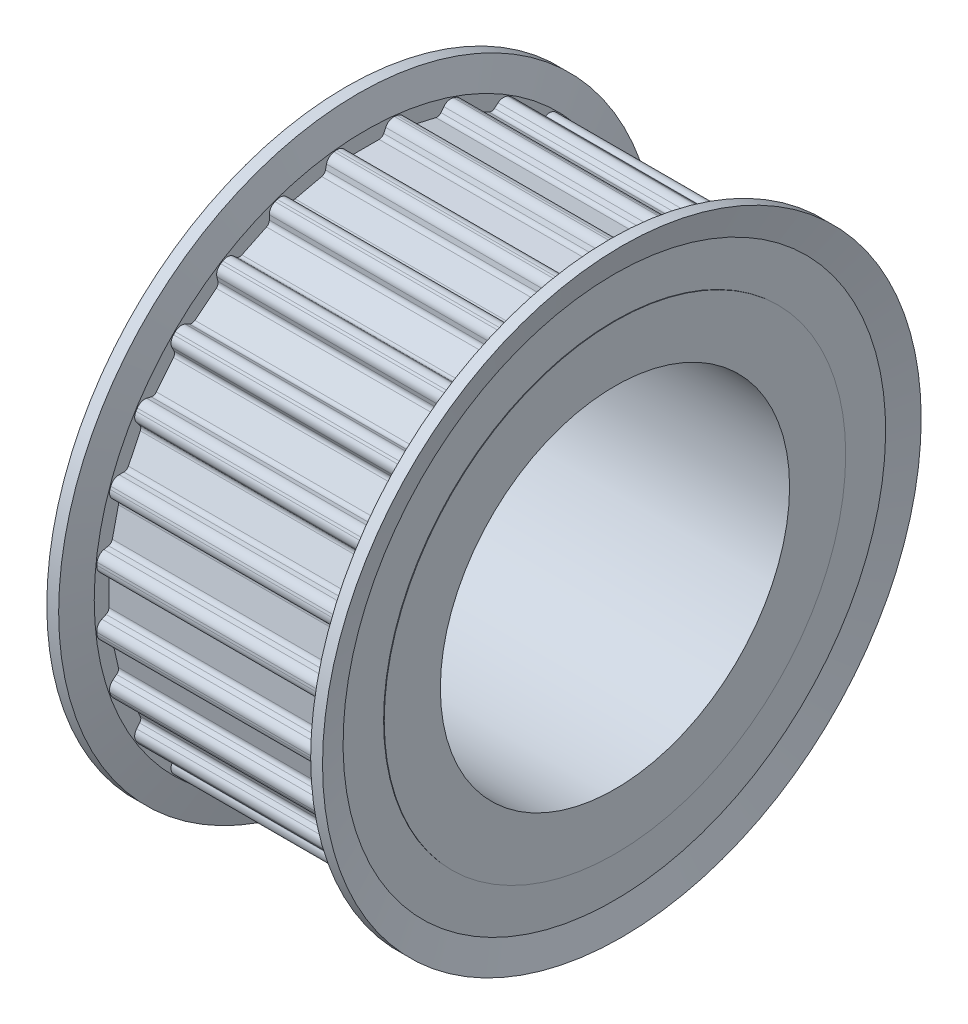
from build123d import *

# Parameters (mm, degrees)
REVOLVE1_START           = 0.05
REVOLVE1_DEPTH           = 20.9
REVOLVE1_START_2         = 20.602885583
REVOLVE1_2_OUTLINE_R     = 24
REVOLVE1_2_DEPTH         = 0.347114417
REVOLVE1_3_OUTLINE_R     = 24
REVOLVE1_3_DEPTH         = 0.347114217
REVOLVE1_4_OUTLINE_R     = 18.5
REVOLVE1_4_DEPTH         = 0.05
F_8_0_8_DIAMETER_HOLE1_D = 8
FILLET1_R                = 0.4
FILLET2_R                = 0.7
SKETCH5_R                = 16
CUT_EXTRUDE1_DEPTH       = 6
SKETCH6_R                = 14
CUT_EXTRUDE2_DEPTH       = 41.206055281


with BuildPart() as part:
    # Revolve1: read off the stored shape, not the designer's step
    # Revolve1 outline → Revolve1 (new body)
    with BuildSketch(Plane.YZ.offset(REVOLVE1_START)):
        with BuildLine():
            ThreePointArc((12.034544373, 18.02106106), (11.529135098, 18.348513397), (11.014821871, 18.661795175))
            Line((11.014821871, 18.661795175), (10.141296485, 17.947186565))
            Line((10.141296485, 17.947186565), (7.708680542, 19.118672661))
            Line((7.708680542, 19.118672661), (7.722749882, 20.247173488))
            ThreePointArc((7.722749882, 20.247173488), (7.157147273, 20.453951768), (6.586017198, 20.644933458))
            Line((6.586017198, 20.644933458), (5.893408293, 19.753863893))
            Line((5.893408293, 19.753863893), (3.26110293, 20.354670414))
            Line((3.26110293, 20.354670414), (3.023704464, 21.458008093))
            ThreePointArc((3.023704464, 21.458008093), (2.426270197, 21.533743588), (1.826962122, 21.592848571))
            Line((1.826962122, 21.592848571), (1.35, 20.57))
            Line((1.35, 20.57), (-1.35, 20.57))
            Line((-1.35, 20.57), (-1.826962122, 21.592848571))
            ThreePointArc((-1.826962122, 21.592848571), (-2.426270197, 21.533743588), (-3.023704464, 21.458008093))
            Line((-3.023704464, 21.458008093), (-3.26110293, 20.354670414))
            Line((-3.26110293, 20.354670414), (-5.893408293, 19.753863893))
            Line((-5.893408293, 19.753863893), (-6.586017198, 20.644933458))
            ThreePointArc((-6.586017198, 20.644933458), (-7.157147273, 20.453951768), (-7.722749882, 20.247173488))
            Line((-7.722749882, 20.247173488), (-7.708680542, 19.118672661))
            Line((-7.708680542, 19.118672661), (-10.141296485, 17.947186565))
            Line((-10.141296485, 17.947186565), (-11.014821871, 18.661795175))
            ThreePointArc((-11.014821871, 18.661795175), (-11.529135098, 18.348513397), (-12.034544373, 18.02106106))
            Line((-12.034544373, 18.02106106), (-11.769712723, 16.923984827))
            Line((-11.769712723, 16.923984827), (-13.880657726, 15.240562362))
            Line((-13.880657726, 15.240562362), (-14.891297381, 15.742876558))
            ThreePointArc((-14.891297381, 15.742876558), (-15.323003948, 15.323003948), (-15.742876558, 14.891297381))
            Line((-15.742876558, 14.891297381), (-15.240562362, 13.880657726))
            Line((-15.240562362, 13.880657726), (-16.923984827, 11.769712723))
            Line((-16.923984827, 11.769712723), (-18.02106106, 12.034544373))
            ThreePointArc((-18.02106106, 12.034544373), (-18.348513397, 11.529135098), (-18.661795175, 11.014821871))
            Line((-18.661795175, 11.014821871), (-17.947186565, 10.141296485))
            Line((-17.947186565, 10.141296485), (-19.118672661, 7.708680542))
            Line((-19.118672661, 7.708680542), (-20.247173488, 7.722749882))
            ThreePointArc((-20.247173488, 7.722749882), (-20.453951768, 7.157147273), (-20.644933458, 6.586017198))
            Line((-20.644933458, 6.586017198), (-19.753863893, 5.893408293))
            Line((-19.753863893, 5.893408293), (-20.354670414, 3.26110293))
            Line((-20.354670414, 3.26110293), (-21.458008093, 3.023704464))
            ThreePointArc((-21.458008093, 3.023704464), (-21.533743588, 2.426270197), (-21.592848571, 1.826962122))
            Line((-21.592848571, 1.826962122), (-20.57, 1.35))
            Line((-20.57, 1.35), (-20.57, -1.35))
            Line((-20.57, -1.35), (-21.592848571, -1.826962122))
            ThreePointArc((-21.592848571, -1.826962122), (-21.533743588, -2.426270197), (-21.458008093, -3.023704464))
            Line((-21.458008093, -3.023704464), (-20.354670414, -3.26110293))
            Line((-20.354670414, -3.26110293), (-19.753863893, -5.893408293))
            Line((-19.753863893, -5.893408293), (-20.644933458, -6.586017198))
            ThreePointArc((-20.644933458, -6.586017198), (-20.453951768, -7.157147273), (-20.247173488, -7.722749882))
            Line((-20.247173488, -7.722749882), (-19.118672661, -7.708680542))
            Line((-19.118672661, -7.708680542), (-17.947186565, -10.141296485))
            Line((-17.947186565, -10.141296485), (-18.661795175, -11.014821871))
            ThreePointArc((-18.661795175, -11.014821871), (-18.348513397, -11.529135098), (-18.02106106, -12.034544373))
            Line((-18.02106106, -12.034544373), (-16.923984827, -11.769712723))
            Line((-16.923984827, -11.769712723), (-15.240562362, -13.880657726))
            Line((-15.240562362, -13.880657726), (-15.742876558, -14.891297381))
            ThreePointArc((-15.742876558, -14.891297381), (-15.323003948, -15.323003948), (-14.891297381, -15.742876558))
            Line((-14.891297381, -15.742876558), (-13.880657726, -15.240562362))
            Line((-13.880657726, -15.240562362), (-11.769712723, -16.923984827))
            Line((-11.769712723, -16.923984827), (-12.034544373, -18.02106106))
            ThreePointArc((-12.034544373, -18.02106106), (-11.529135098, -18.348513397), (-11.014821871, -18.661795175))
            Line((-11.014821871, -18.661795175), (-10.141296485, -17.947186565))
            Line((-10.141296485, -17.947186565), (-7.708680542, -19.118672661))
            Line((-7.708680542, -19.118672661), (-7.722749882, -20.247173488))
            ThreePointArc((-7.722749882, -20.247173488), (-7.157147273, -20.453951768), (-6.586017198, -20.644933458))
            Line((-6.586017198, -20.644933458), (-5.893408293, -19.753863893))
            Line((-5.893408293, -19.753863893), (-3.26110293, -20.354670414))
            Line((-3.26110293, -20.354670414), (-3.023704464, -21.458008093))
            ThreePointArc((-3.023704464, -21.458008093), (-2.426270197, -21.533743588), (-1.826962122, -21.592848571))
            Line((-1.826962122, -21.592848571), (-1.35, -20.57))
            Line((-1.35, -20.57), (1.35, -20.57))
            Line((1.35, -20.57), (1.826962122, -21.592848571))
            ThreePointArc((1.826962122, -21.592848571), (2.426270197, -21.533743588), (3.023704464, -21.458008093))
            Line((3.023704464, -21.458008093), (3.26110293, -20.354670414))
            Line((3.26110293, -20.354670414), (5.893408293, -19.753863893))
            Line((5.893408293, -19.753863893), (6.586017198, -20.644933458))
            ThreePointArc((6.586017198, -20.644933458), (7.157147273, -20.453951768), (7.722749882, -20.247173488))
            Line((7.722749882, -20.247173488), (7.708680542, -19.118672661))
            Line((7.708680542, -19.118672661), (10.141296485, -17.947186565))
            Line((10.141296485, -17.947186565), (11.014821871, -18.661795175))
            ThreePointArc((11.014821871, -18.661795175), (11.529135098, -18.348513397), (12.034544373, -18.02106106))
            Line((12.034544373, -18.02106106), (11.769712723, -16.923984827))
            Line((11.769712723, -16.923984827), (13.880657726, -15.240562362))
            Line((13.880657726, -15.240562362), (14.891297381, -15.742876558))
            ThreePointArc((14.891297381, -15.742876558), (15.323003948, -15.323003948), (15.742876558, -14.891297381))
            Line((15.742876558, -14.891297381), (15.240562362, -13.880657726))
            Line((15.240562362, -13.880657726), (16.923984827, -11.769712723))
            Line((16.923984827, -11.769712723), (18.02106106, -12.034544373))
            ThreePointArc((18.02106106, -12.034544373), (18.348513397, -11.529135098), (18.661795175, -11.014821871))
            Line((18.661795175, -11.014821871), (17.947186565, -10.141296485))
            Line((17.947186565, -10.141296485), (19.118672661, -7.708680542))
            Line((19.118672661, -7.708680542), (20.247173488, -7.722749882))
            ThreePointArc((20.247173488, -7.722749882), (20.453951768, -7.157147273), (20.644933458, -6.586017198))
            Line((20.644933458, -6.586017198), (19.753863893, -5.893408293))
            Line((19.753863893, -5.893408293), (20.354670414, -3.26110293))
            Line((20.354670414, -3.26110293), (21.458008093, -3.023704464))
            ThreePointArc((21.458008093, -3.023704464), (21.533743588, -2.426270197), (21.592848571, -1.826962122))
            Line((21.592848571, -1.826962122), (20.57, -1.35))
            Line((20.57, -1.35), (20.57, 1.35))
            Line((20.57, 1.35), (21.592848571, 1.826962122))
            ThreePointArc((21.592848571, 1.826962122), (21.533743588, 2.426270197), (21.458008093, 3.023704464))
            Line((21.458008093, 3.023704464), (20.354670414, 3.26110293))
            Line((20.354670414, 3.26110293), (19.753863893, 5.893408293))
            Line((19.753863893, 5.893408293), (20.644933458, 6.586017198))
            ThreePointArc((20.644933458, 6.586017198), (20.453951768, 7.157147273), (20.247173488, 7.722749882))
            Line((20.247173488, 7.722749882), (19.118672661, 7.708680542))
            Line((19.118672661, 7.708680542), (17.947186565, 10.141296485))
            Line((17.947186565, 10.141296485), (18.661795175, 11.014821871))
            ThreePointArc((18.661795175, 11.014821871), (18.348513397, 11.529135098), (18.02106106, 12.034544373))
            Line((18.02106106, 12.034544373), (16.923984827, 11.769712723))
            Line((16.923984827, 11.769712723), (15.240562362, 13.880657726))
            Line((15.240562362, 13.880657726), (15.742876558, 14.891297381))
            ThreePointArc((15.742876558, 14.891297381), (15.323003948, 15.323003948), (14.891297381, 15.742876558))
            Line((14.891297381, 15.742876558), (13.880657726, 15.240562362))
            Line((13.880657726, 15.240562362), (11.769712723, 16.923984827))
            Line((11.769712723, 16.923984827), (12.034544373, 18.02106106))
        make_face()
    extrude(amount=REVOLVE1_DEPTH)

    # Revolve1 2 outline → Revolve1 2 (add)
    with BuildSketch(Plane.YZ.offset(REVOLVE1_START_2)):
        Circle(REVOLVE1_2_OUTLINE_R)
        with BuildLine():
            Line((10.141296485, 17.947186565), (11.014821871, 18.661795175))
            ThreePointArc((11.014821871, 18.661795175), (11.529135098, 18.348513397), (12.034544373, 18.02106106))
            Line((12.034544373, 18.02106106), (11.769712723, 16.923984827))
            Line((11.769712723, 16.923984827), (13.880657726, 15.240562362))
            Line((13.880657726, 15.240562362), (14.891297381, 15.742876558))
            ThreePointArc((14.891297381, 15.742876558), (15.323003948, 15.323003948), (15.742876558, 14.891297381))
            Line((15.742876558, 14.891297381), (15.240562362, 13.880657726))
            Line((15.240562362, 13.880657726), (16.923984827, 11.769712723))
            Line((16.923984827, 11.769712723), (18.02106106, 12.034544373))
            ThreePointArc((18.02106106, 12.034544373), (18.348513397, 11.529135098), (18.661795175, 11.014821871))
            Line((18.661795175, 11.014821871), (17.947186565, 10.141296485))
            Line((17.947186565, 10.141296485), (19.118672661, 7.708680542))
            Line((19.118672661, 7.708680542), (20.247173488, 7.722749882))
            ThreePointArc((20.247173488, 7.722749882), (20.453951768, 7.157147273), (20.644933458, 6.586017198))
            Line((20.644933458, 6.586017198), (19.753863893, 5.893408293))
            Line((19.753863893, 5.893408293), (20.354670414, 3.26110293))
            Line((20.354670414, 3.26110293), (21.458008093, 3.023704464))
            ThreePointArc((21.458008093, 3.023704464), (21.533743588, 2.426270197), (21.592848571, 1.826962122))
            Line((21.592848571, 1.826962122), (20.57, 1.35))
            Line((20.57, 1.35), (20.57, -1.35))
            Line((20.57, -1.35), (21.592848571, -1.826962122))
            ThreePointArc((21.592848571, -1.826962122), (21.533743588, -2.426270197), (21.458008093, -3.023704464))
            Line((21.458008093, -3.023704464), (20.354670414, -3.26110293))
            Line((20.354670414, -3.26110293), (19.753863893, -5.893408293))
            Line((19.753863893, -5.893408293), (20.644933458, -6.586017198))
            ThreePointArc((20.644933458, -6.586017198), (20.453951768, -7.157147273), (20.247173488, -7.722749882))
            Line((20.247173488, -7.722749882), (19.118672661, -7.708680542))
            Line((19.118672661, -7.708680542), (17.947186565, -10.141296485))
            Line((17.947186565, -10.141296485), (18.661795175, -11.014821871))
            ThreePointArc((18.661795175, -11.014821871), (18.348513397, -11.529135098), (18.02106106, -12.034544373))
            Line((18.02106106, -12.034544373), (16.923984827, -11.769712723))
            Line((16.923984827, -11.769712723), (15.240562362, -13.880657726))
            Line((15.240562362, -13.880657726), (15.742876558, -14.891297381))
            ThreePointArc((15.742876558, -14.891297381), (15.323003948, -15.323003948), (14.891297381, -15.742876558))
            Line((14.891297381, -15.742876558), (13.880657726, -15.240562362))
            Line((13.880657726, -15.240562362), (11.769712723, -16.923984827))
            Line((11.769712723, -16.923984827), (12.034544373, -18.02106106))
            ThreePointArc((12.034544373, -18.02106106), (11.529135098, -18.348513397), (11.014821871, -18.661795175))
            Line((11.014821871, -18.661795175), (10.141296485, -17.947186565))
            Line((10.141296485, -17.947186565), (7.708680542, -19.118672661))
            Line((7.708680542, -19.118672661), (7.722749882, -20.247173488))
            ThreePointArc((7.722749882, -20.247173488), (7.157147273, -20.453951768), (6.586017198, -20.644933458))
            Line((6.586017198, -20.644933458), (5.893408293, -19.753863893))
            Line((5.893408293, -19.753863893), (3.26110293, -20.354670414))
            Line((3.26110293, -20.354670414), (3.023704464, -21.458008093))
            ThreePointArc((3.023704464, -21.458008093), (2.426270197, -21.533743588), (1.826962122, -21.592848571))
            Line((1.826962122, -21.592848571), (1.35, -20.57))
            Line((1.35, -20.57), (-1.35, -20.57))
            Line((-1.35, -20.57), (-1.826962122, -21.592848571))
            ThreePointArc((-1.826962122, -21.592848571), (-2.426270197, -21.533743588), (-3.023704464, -21.458008093))
            Line((-3.023704464, -21.458008093), (-3.26110293, -20.354670414))
            Line((-3.26110293, -20.354670414), (-5.893408293, -19.753863893))
            Line((-5.893408293, -19.753863893), (-6.586017198, -20.644933458))
            ThreePointArc((-6.586017198, -20.644933458), (-7.157147273, -20.453951768), (-7.722749882, -20.247173488))
            Line((-7.722749882, -20.247173488), (-7.708680542, -19.118672661))
            Line((-7.708680542, -19.118672661), (-10.141296485, -17.947186565))
            Line((-10.141296485, -17.947186565), (-11.014821871, -18.661795175))
            ThreePointArc((-11.014821871, -18.661795175), (-11.529135098, -18.348513397), (-12.034544373, -18.02106106))
            Line((-12.034544373, -18.02106106), (-11.769712723, -16.923984827))
            Line((-11.769712723, -16.923984827), (-13.880657726, -15.240562362))
            Line((-13.880657726, -15.240562362), (-14.891297381, -15.742876558))
            ThreePointArc((-14.891297381, -15.742876558), (-15.323003948, -15.323003948), (-15.742876558, -14.891297381))
            Line((-15.742876558, -14.891297381), (-15.240562362, -13.880657726))
            Line((-15.240562362, -13.880657726), (-16.923984827, -11.769712723))
            Line((-16.923984827, -11.769712723), (-18.02106106, -12.034544373))
            ThreePointArc((-18.02106106, -12.034544373), (-18.348513397, -11.529135098), (-18.661795175, -11.014821871))
            Line((-18.661795175, -11.014821871), (-17.947186565, -10.141296485))
            Line((-17.947186565, -10.141296485), (-19.118672661, -7.708680542))
            Line((-19.118672661, -7.708680542), (-20.247173488, -7.722749882))
            ThreePointArc((-20.247173488, -7.722749882), (-20.453951768, -7.157147273), (-20.644933458, -6.586017198))
            Line((-20.644933458, -6.586017198), (-19.753863893, -5.893408293))
            Line((-19.753863893, -5.893408293), (-20.354670414, -3.26110293))
            Line((-20.354670414, -3.26110293), (-21.458008093, -3.023704464))
            ThreePointArc((-21.458008093, -3.023704464), (-21.533743588, -2.426270197), (-21.592848571, -1.826962122))
            Line((-21.592848571, -1.826962122), (-20.57, -1.35))
            Line((-20.57, -1.35), (-20.57, 1.35))
            Line((-20.57, 1.35), (-21.592848571, 1.826962122))
            ThreePointArc((-21.592848571, 1.826962122), (-21.533743588, 2.426270197), (-21.458008093, 3.023704464))
            Line((-21.458008093, 3.023704464), (-20.354670414, 3.26110293))
            Line((-20.354670414, 3.26110293), (-19.753863893, 5.893408293))
            Line((-19.753863893, 5.893408293), (-20.644933458, 6.586017198))
            ThreePointArc((-20.644933458, 6.586017198), (-20.453951768, 7.157147273), (-20.247173488, 7.722749882))
            Line((-20.247173488, 7.722749882), (-19.118672661, 7.708680542))
            Line((-19.118672661, 7.708680542), (-17.947186565, 10.141296485))
            Line((-17.947186565, 10.141296485), (-18.661795175, 11.014821871))
            ThreePointArc((-18.661795175, 11.014821871), (-18.348513397, 11.529135098), (-18.02106106, 12.034544373))
            Line((-18.02106106, 12.034544373), (-16.923984827, 11.769712723))
            Line((-16.923984827, 11.769712723), (-15.240562362, 13.880657726))
            Line((-15.240562362, 13.880657726), (-15.742876558, 14.891297381))
            ThreePointArc((-15.742876558, 14.891297381), (-15.323003948, 15.323003948), (-14.891297381, 15.742876558))
            Line((-14.891297381, 15.742876558), (-13.880657726, 15.240562362))
            Line((-13.880657726, 15.240562362), (-11.769712723, 16.923984827))
            Line((-11.769712723, 16.923984827), (-12.034544373, 18.02106106))
            ThreePointArc((-12.034544373, 18.02106106), (-11.529135098, 18.348513397), (-11.014821871, 18.661795175))
            Line((-11.014821871, 18.661795175), (-10.141296485, 17.947186565))
            Line((-10.141296485, 17.947186565), (-7.708680542, 19.118672661))
            Line((-7.708680542, 19.118672661), (-7.722749882, 20.247173488))
            ThreePointArc((-7.722749882, 20.247173488), (-7.157147273, 20.453951768), (-6.586017198, 20.644933458))
            Line((-6.586017198, 20.644933458), (-5.893408293, 19.753863893))
            Line((-5.893408293, 19.753863893), (-3.26110293, 20.354670414))
            Line((-3.26110293, 20.354670414), (-3.023704464, 21.458008093))
            ThreePointArc((-3.023704464, 21.458008093), (-2.426270197, 21.533743588), (-1.826962122, 21.592848571))
            Line((-1.826962122, 21.592848571), (-1.35, 20.57))
            Line((-1.35, 20.57), (1.35, 20.57))
            Line((1.35, 20.57), (1.826962122, 21.592848571))
            ThreePointArc((1.826962122, 21.592848571), (2.426270197, 21.533743588), (3.023704464, 21.458008093))
            Line((3.023704464, 21.458008093), (3.26110293, 20.354670414))
            Line((3.26110293, 20.354670414), (5.893408293, 19.753863893))
            Line((5.893408293, 19.753863893), (6.586017198, 20.644933458))
            ThreePointArc((6.586017198, 20.644933458), (7.157147273, 20.453951768), (7.722749882, 20.247173488))
            Line((7.722749882, 20.247173488), (7.708680542, 19.118672661))
            Line((7.708680542, 19.118672661), (10.141296485, 17.947186565))
        make_face(mode=Mode.SUBTRACT)
    extrude(amount=REVOLVE1_2_DEPTH)

    # Revolve1 3 outline → Revolve1 3 (add)
    with BuildSketch(Plane.YZ.offset(REVOLVE1_START)):
        Circle(REVOLVE1_3_OUTLINE_R)
        with BuildLine():
            Line((10.141296485, 17.947186565), (11.014821871, 18.661795175))
            ThreePointArc((11.014821871, 18.661795175), (11.529135098, 18.348513397), (12.034544373, 18.02106106))
            Line((12.034544373, 18.02106106), (11.769712723, 16.923984827))
            Line((11.769712723, 16.923984827), (13.880657726, 15.240562362))
            Line((13.880657726, 15.240562362), (14.891297381, 15.742876558))
            ThreePointArc((14.891297381, 15.742876558), (15.323003948, 15.323003948), (15.742876558, 14.891297381))
            Line((15.742876558, 14.891297381), (15.240562362, 13.880657726))
            Line((15.240562362, 13.880657726), (16.923984827, 11.769712723))
            Line((16.923984827, 11.769712723), (18.02106106, 12.034544373))
            ThreePointArc((18.02106106, 12.034544373), (18.348513397, 11.529135098), (18.661795175, 11.014821871))
            Line((18.661795175, 11.014821871), (17.947186565, 10.141296485))
            Line((17.947186565, 10.141296485), (19.118672661, 7.708680542))
            Line((19.118672661, 7.708680542), (20.247173488, 7.722749882))
            ThreePointArc((20.247173488, 7.722749882), (20.453951768, 7.157147273), (20.644933458, 6.586017198))
            Line((20.644933458, 6.586017198), (19.753863893, 5.893408293))
            Line((19.753863893, 5.893408293), (20.354670414, 3.26110293))
            Line((20.354670414, 3.26110293), (21.458008093, 3.023704464))
            ThreePointArc((21.458008093, 3.023704464), (21.533743588, 2.426270197), (21.592848571, 1.826962122))
            Line((21.592848571, 1.826962122), (20.57, 1.35))
            Line((20.57, 1.35), (20.57, -1.35))
            Line((20.57, -1.35), (21.592848571, -1.826962122))
            ThreePointArc((21.592848571, -1.826962122), (21.533743588, -2.426270197), (21.458008093, -3.023704464))
            Line((21.458008093, -3.023704464), (20.354670414, -3.26110293))
            Line((20.354670414, -3.26110293), (19.753863893, -5.893408293))
            Line((19.753863893, -5.893408293), (20.644933458, -6.586017198))
            ThreePointArc((20.644933458, -6.586017198), (20.453951768, -7.157147273), (20.247173488, -7.722749882))
            Line((20.247173488, -7.722749882), (19.118672661, -7.708680542))
            Line((19.118672661, -7.708680542), (17.947186565, -10.141296485))
            Line((17.947186565, -10.141296485), (18.661795175, -11.014821871))
            ThreePointArc((18.661795175, -11.014821871), (18.348513397, -11.529135098), (18.02106106, -12.034544373))
            Line((18.02106106, -12.034544373), (16.923984827, -11.769712723))
            Line((16.923984827, -11.769712723), (15.240562362, -13.880657726))
            Line((15.240562362, -13.880657726), (15.742876558, -14.891297381))
            ThreePointArc((15.742876558, -14.891297381), (15.323003948, -15.323003948), (14.891297381, -15.742876558))
            Line((14.891297381, -15.742876558), (13.880657726, -15.240562362))
            Line((13.880657726, -15.240562362), (11.769712723, -16.923984827))
            Line((11.769712723, -16.923984827), (12.034544373, -18.02106106))
            ThreePointArc((12.034544373, -18.02106106), (11.529135098, -18.348513397), (11.014821871, -18.661795175))
            Line((11.014821871, -18.661795175), (10.141296485, -17.947186565))
            Line((10.141296485, -17.947186565), (7.708680542, -19.118672661))
            Line((7.708680542, -19.118672661), (7.722749882, -20.247173488))
            ThreePointArc((7.722749882, -20.247173488), (7.157147273, -20.453951768), (6.586017198, -20.644933458))
            Line((6.586017198, -20.644933458), (5.893408293, -19.753863893))
            Line((5.893408293, -19.753863893), (3.26110293, -20.354670414))
            Line((3.26110293, -20.354670414), (3.023704464, -21.458008093))
            ThreePointArc((3.023704464, -21.458008093), (2.426270197, -21.533743588), (1.826962122, -21.592848571))
            Line((1.826962122, -21.592848571), (1.35, -20.57))
            Line((1.35, -20.57), (-1.35, -20.57))
            Line((-1.35, -20.57), (-1.826962122, -21.592848571))
            ThreePointArc((-1.826962122, -21.592848571), (-2.426270197, -21.533743588), (-3.023704464, -21.458008093))
            Line((-3.023704464, -21.458008093), (-3.26110293, -20.354670414))
            Line((-3.26110293, -20.354670414), (-5.893408293, -19.753863893))
            Line((-5.893408293, -19.753863893), (-6.586017198, -20.644933458))
            ThreePointArc((-6.586017198, -20.644933458), (-7.157147273, -20.453951768), (-7.722749882, -20.247173488))
            Line((-7.722749882, -20.247173488), (-7.708680542, -19.118672661))
            Line((-7.708680542, -19.118672661), (-10.141296485, -17.947186565))
            Line((-10.141296485, -17.947186565), (-11.014821871, -18.661795175))
            ThreePointArc((-11.014821871, -18.661795175), (-11.529135098, -18.348513397), (-12.034544373, -18.02106106))
            Line((-12.034544373, -18.02106106), (-11.769712723, -16.923984827))
            Line((-11.769712723, -16.923984827), (-13.880657726, -15.240562362))
            Line((-13.880657726, -15.240562362), (-14.891297381, -15.742876558))
            ThreePointArc((-14.891297381, -15.742876558), (-15.323003948, -15.323003948), (-15.742876558, -14.891297381))
            Line((-15.742876558, -14.891297381), (-15.240562362, -13.880657726))
            Line((-15.240562362, -13.880657726), (-16.923984827, -11.769712723))
            Line((-16.923984827, -11.769712723), (-18.02106106, -12.034544373))
            ThreePointArc((-18.02106106, -12.034544373), (-18.348513397, -11.529135098), (-18.661795175, -11.014821871))
            Line((-18.661795175, -11.014821871), (-17.947186565, -10.141296485))
            Line((-17.947186565, -10.141296485), (-19.118672661, -7.708680542))
            Line((-19.118672661, -7.708680542), (-20.247173488, -7.722749882))
            ThreePointArc((-20.247173488, -7.722749882), (-20.453951768, -7.157147273), (-20.644933458, -6.586017198))
            Line((-20.644933458, -6.586017198), (-19.753863893, -5.893408293))
            Line((-19.753863893, -5.893408293), (-20.354670414, -3.26110293))
            Line((-20.354670414, -3.26110293), (-21.458008093, -3.023704464))
            ThreePointArc((-21.458008093, -3.023704464), (-21.533743588, -2.426270197), (-21.592848571, -1.826962122))
            Line((-21.592848571, -1.826962122), (-20.57, -1.35))
            Line((-20.57, -1.35), (-20.57, 1.35))
            Line((-20.57, 1.35), (-21.592848571, 1.826962122))
            ThreePointArc((-21.592848571, 1.826962122), (-21.533743588, 2.426270197), (-21.458008093, 3.023704464))
            Line((-21.458008093, 3.023704464), (-20.354670414, 3.26110293))
            Line((-20.354670414, 3.26110293), (-19.753863893, 5.893408293))
            Line((-19.753863893, 5.893408293), (-20.644933458, 6.586017198))
            ThreePointArc((-20.644933458, 6.586017198), (-20.453951768, 7.157147273), (-20.247173488, 7.722749882))
            Line((-20.247173488, 7.722749882), (-19.118672661, 7.708680542))
            Line((-19.118672661, 7.708680542), (-17.947186565, 10.141296485))
            Line((-17.947186565, 10.141296485), (-18.661795175, 11.014821871))
            ThreePointArc((-18.661795175, 11.014821871), (-18.348513397, 11.529135098), (-18.02106106, 12.034544373))
            Line((-18.02106106, 12.034544373), (-16.923984827, 11.769712723))
            Line((-16.923984827, 11.769712723), (-15.240562362, 13.880657726))
            Line((-15.240562362, 13.880657726), (-15.742876558, 14.891297381))
            ThreePointArc((-15.742876558, 14.891297381), (-15.323003948, 15.323003948), (-14.891297381, 15.742876558))
            Line((-14.891297381, 15.742876558), (-13.880657726, 15.240562362))
            Line((-13.880657726, 15.240562362), (-11.769712723, 16.923984827))
            Line((-11.769712723, 16.923984827), (-12.034544373, 18.02106106))
            ThreePointArc((-12.034544373, 18.02106106), (-11.529135098, 18.348513397), (-11.014821871, 18.661795175))
            Line((-11.014821871, 18.661795175), (-10.141296485, 17.947186565))
            Line((-10.141296485, 17.947186565), (-7.708680542, 19.118672661))
            Line((-7.708680542, 19.118672661), (-7.722749882, 20.247173488))
            ThreePointArc((-7.722749882, 20.247173488), (-7.157147273, 20.453951768), (-6.586017198, 20.644933458))
            Line((-6.586017198, 20.644933458), (-5.893408293, 19.753863893))
            Line((-5.893408293, 19.753863893), (-3.26110293, 20.354670414))
            Line((-3.26110293, 20.354670414), (-3.023704464, 21.458008093))
            ThreePointArc((-3.023704464, 21.458008093), (-2.426270197, 21.533743588), (-1.826962122, 21.592848571))
            Line((-1.826962122, 21.592848571), (-1.35, 20.57))
            Line((-1.35, 20.57), (1.35, 20.57))
            Line((1.35, 20.57), (1.826962122, 21.592848571))
            ThreePointArc((1.826962122, 21.592848571), (2.426270197, 21.533743588), (3.023704464, 21.458008093))
            Line((3.023704464, 21.458008093), (3.26110293, 20.354670414))
            Line((3.26110293, 20.354670414), (5.893408293, 19.753863893))
            Line((5.893408293, 19.753863893), (6.586017198, 20.644933458))
            ThreePointArc((6.586017198, 20.644933458), (7.157147273, 20.453951768), (7.722749882, 20.247173488))
            Line((7.722749882, 20.247173488), (7.708680542, 19.118672661))
            Line((7.708680542, 19.118672661), (10.141296485, 17.947186565))
        make_face(mode=Mode.SUBTRACT)
    extrude(amount=REVOLVE1_3_DEPTH)

    # Revolve1 4 outline → Revolve1 4 (add)
    with BuildSketch(Plane.YZ):
        Circle(REVOLVE1_4_OUTLINE_R)
    extrude(amount=REVOLVE1_4_DEPTH)

    # Revolve1 5 outline → Revolve1 5 (revolve)
    with BuildSketch(Plane.YX):
        Polygon((24, 20.602885643), (20.57, 20.602885583), (20.57, 20), (21.75, 20), align=None)
        Polygon((20.57, 0.397114217), (24, 0.397114277), (21.75, 1), (20.57, 1), align=None)
        Polygon((21.75, 20.95), (24, 20.95), (24, 21.552885683), align=None)
        Polygon((24, -0.552885683), (24, 0.05), (21.75, 0.05), align=None)
    revolve(axis=Axis((0, 0, 0), (1, 0, 0)))

    # Sketch2 → Revolve2 (revolve)
    with BuildSketch(Plane(origin=(0, 0, 0), x_dir=(-1, 0, 0), z_dir=(0, 0, -1)), mode=Mode.PRIVATE) as revolve2_sk:
        Polygon((-27, 16), (-27, 0), (-20.95, 0), (-20.95, 18.5), (-21, 18.5), (-21, 16), align=None)
    revolve(revolve2_sk.sketch.rotate(Axis((27, 0, 0), (-1, 0, 0)), 270), axis=Axis((27, 0, 0), (-1, 0, 0)))

    # Ø8.0 (8) Diameter Hole1 (through all)
    with Locations(Plane(origin=(27, 0, 0), x_dir=(0, 0, -1), z_dir=(1, 0, 0))):
        with Locations((0, 0)):
            Hole(F_8_0_8_DIAMETER_HOLE1_D / 2)

    # Fillet1
    fillet1_edges = [part.edges().sort_by_distance(p)[0] for p in [
        (10.5, -13.880657726, -15.240562362),
        (10.5, -11.769712723, 16.923984827),
        (10.5, -20.57, 1.35),
        (10.5, 10.141296485, 17.947186565),
        (10.5, 5.893408293, 19.753863893),
        (10.5, 11.769712723, 16.923984827),
        (10.5, -19.118672661, -7.708680542),
        (10.5, 13.880657726, 15.240562362),
        (10.5, -17.947186565, 10.141296485),
        (10.5, 15.240562362, 13.880657726),
        (10.5, -3.26110293, 20.354670414),
        (10.5, 16.923984827, 11.769712723),
        (10.5, -10.141296485, -17.947186565),
        (10.5, 17.947186565, 10.141296485),
        (10.5, -16.923984827, -11.769712723),
        (10.5, 19.118672661, 7.708680542),
        (10.5, -20.354670414, -3.26110293),
        (10.5, 19.753863893, 5.893408293),
        (10.5, -19.753863893, 5.893408293),
        (10.5, 20.354670414, 3.26110293),
        (10.5, -15.240562362, 13.880657726),
        (10.5, 20.57, 1.35),
        (10.5, -7.708680542, 19.118672661),
        (10.5, 20.57, -1.35),
        (10.5, 1.35, 20.57),
        (10.5, 20.354670414, -3.26110293),
        (10.5, -7.708680542, -19.118672661),
        (10.5, 19.753863893, -5.893408293),
        (10.5, -11.769712723, -16.923984827),
        (10.5, 19.118672661, -7.708680542),
        (10.5, -15.240562362, -13.880657726),
        (10.5, 17.947186565, -10.141296485),
        (10.5, -17.947186565, -10.141296485),
        (10.5, 16.923984827, -11.769712723),
        (10.5, -19.753863893, -5.893408293),
        (10.5, 15.240562362, -13.880657726),
        (10.5, -20.57, -1.35),
        (10.5, 13.880657726, -15.240562362),
        (10.5, -20.354670414, 3.26110293),
        (10.5, 11.769712723, -16.923984827),
        (10.5, -19.118672661, 7.708680542),
        (10.5, 10.141296485, -17.947186565),
        (10.5, -16.923984827, 11.769712723),
        (10.5, 7.708680542, -19.118672661),
        (10.5, -13.880657726, 15.240562362),
        (10.5, 5.893408293, -19.753863893),
        (10.5, -10.141296485, 17.947186565),
        (10.5, 3.26110293, -20.354670414),
        (10.5, -5.893408293, 19.753863893),
        (10.5, 1.35, -20.57),
        (10.5, -1.35, 20.57),
        (10.5, -1.35, -20.57),
        (10.5, 3.26110293, 20.354670414),
        (10.5, -3.26110293, -20.354670414),
        (10.5, 7.708680542, 19.118672661),
        (10.5, -5.893408293, -19.753863893),
    ]]
    fillet(fillet1_edges, radius=FILLET1_R)

    # Fillet2
    fillet2_edges = [part.edges().sort_by_distance(p)[0] for p in [
        (10.5, -14.891297381, -15.742876558),
        (10.5, -12.034544373, 18.02106106),
        (10.5, -21.592848571, 1.826962122),
        (10.5, 11.014821871, 18.661795175),
        (10.5, 7.722749882, 20.247173488),
        (10.5, 12.034544373, 18.02106106),
        (10.5, -20.247173488, -7.722749882),
        (10.5, 14.891297381, 15.742876558),
        (10.5, -18.661795175, 11.014821871),
        (10.5, 15.742876558, 14.891297381),
        (10.5, -3.023704464, 21.458008093),
        (10.5, 18.02106106, 12.034544373),
        (10.5, -11.014821871, -18.661795175),
        (10.5, 18.661795175, 11.014821871),
        (10.5, -18.02106106, -12.034544373),
        (10.5, 20.247173488, 7.722749882),
        (10.5, -21.458008093, -3.023704464),
        (10.5, 20.644933458, 6.586017198),
        (10.5, -20.644933458, 6.586017198),
        (10.5, 21.458008093, 3.023704464),
        (10.5, -15.742876558, 14.891297381),
        (10.5, 21.592848571, 1.826962122),
        (10.5, -7.722749882, 20.247173488),
        (10.5, 21.592848571, -1.826962122),
        (10.5, 1.826962122, 21.592848571),
        (10.5, 21.458008093, -3.023704464),
        (10.5, -7.722749882, -20.247173488),
        (10.5, 20.644933458, -6.586017198),
        (10.5, -12.034544373, -18.02106106),
        (10.5, 20.247173488, -7.722749882),
        (10.5, -15.742876558, -14.891297381),
        (10.5, 18.661795175, -11.014821871),
        (10.5, -18.661795175, -11.014821871),
        (10.5, 18.02106106, -12.034544373),
        (10.5, -20.644933458, -6.586017198),
        (10.5, 15.742876558, -14.891297381),
        (10.5, -21.592848571, -1.826962122),
        (10.5, 14.891297381, -15.742876558),
        (10.5, -21.458008093, 3.023704464),
        (10.5, 12.034544373, -18.02106106),
        (10.5, -20.247173488, 7.722749882),
        (10.5, 11.014821871, -18.661795175),
        (10.5, -18.02106106, 12.034544373),
        (10.5, 7.722749882, -20.247173488),
        (10.5, -14.891297381, 15.742876558),
        (10.5, 6.586017198, -20.644933458),
        (10.5, -11.014821871, 18.661795175),
        (10.5, 3.023704464, -21.458008093),
        (10.5, -6.586017198, 20.644933458),
        (10.5, 1.826962122, -21.592848571),
        (10.5, -1.826962122, 21.592848571),
        (10.5, -1.826962122, -21.592848571),
        (10.5, 3.023704464, 21.458008093),
        (10.5, -3.023704464, -21.458008093),
        (10.5, -6.586017198, -20.644933458),
        (10.5, 6.586017198, 20.644933458),
    ]]
    fillet(fillet2_edges, radius=FILLET2_R)

    # Sketch5 → Cut-Extrude1 (cut)
    with BuildSketch(Plane(origin=(27, 0, 0), x_dir=(0, 0, -1), z_dir=(1, 0, 0))):
        Circle(SKETCH5_R)
    extrude(amount=-CUT_EXTRUDE1_DEPTH, mode=Mode.SUBTRACT)

    # Sketch6 → Cut-Extrude2 (cut, through all)
    with BuildSketch(Plane(origin=(21, 0, 0), x_dir=(0, 0, -1), z_dir=(1, 0, 0))):
        Circle(SKETCH6_R)
    extrude(amount=-CUT_EXTRUDE2_DEPTH, mode=Mode.SUBTRACT)


solid = part.part
